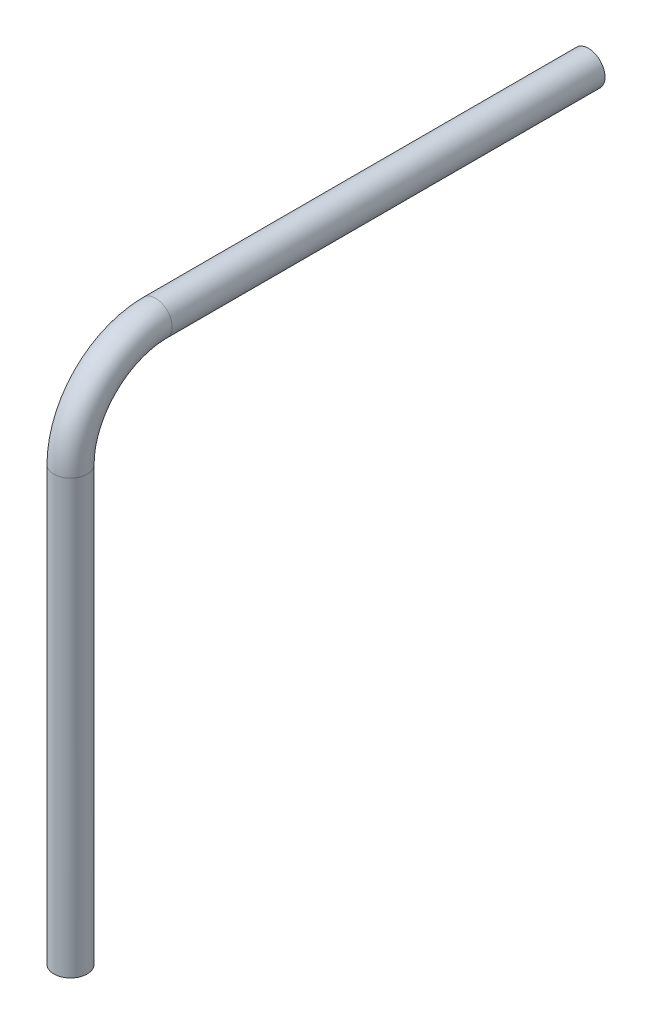
from build123d import *

# Parameters (mm, degrees)
SKETCH3_R           = 12.7
SKETCH3_R_2         = 4.7625
SKETCH4_R           = 12.7
SKETCH4_R_2         = 4.7625
BOSS_EXTRUDE3_DEPTH = 330.2
SKETCH5_R           = 12.7
SKETCH5_R_2         = 4.7625
BOSS_EXTRUDE4_DEPTH = 330.2
SKETCH6_W           = 12.7
SKETCH6_H           = 152.4
CUT_EXTRUDE1_DEPTH  = 6.35


with BuildPart() as part:
    # Sweep1: sweep along a path in Sketch2
    with BuildLine(Plane(origin=(0, 0, 0), x_dir=(0, 0, -1), z_dir=(1, 0, 0))) as sweep1_path:
        ThreePointArc((-64.833774642, 0), (-45.844401699, 45.844401699), (0, 64.833774642))
    # Sketch3 → Sweep1 (sweep)
    with BuildSketch(Plane(origin=(0, 0, 0), x_dir=(1, 0, 0), z_dir=(0, 1, 0))):
        with Locations((0, -64.833774642)):
            Circle(SKETCH3_R)
        with Locations((0, -64.833774642)):
            Circle(SKETCH3_R_2, mode=Mode.SUBTRACT)
    sweep(path=sweep1_path.line)

    # Sketch4 → Boss-Extrude3 (add)
    with BuildSketch(Plane(origin=(0, 0, 0), x_dir=(-1, 0, 0), z_dir=(0, -1, 0))):
        with Locations((0, -64.833774642)):
            Circle(SKETCH4_R)
        with Locations((0, -64.833774642)):
            Circle(SKETCH4_R_2, mode=Mode.SUBTRACT)
    extrude(amount=BOSS_EXTRUDE3_DEPTH)

    # Sketch5 → Boss-Extrude4 (add)
    with BuildSketch(Plane(origin=(0, 0, 0), x_dir=(-1, 0, 0), z_dir=(0, 0, -1))):
        with Locations((0, 64.833774642)):
            Circle(SKETCH5_R)
        with Locations((0, 64.833774642)):
            Circle(SKETCH5_R_2, mode=Mode.SUBTRACT)
    extrude(amount=BOSS_EXTRUDE4_DEPTH)

    # Sketch6 → Cut-Extrude1 (cut)
    with BuildSketch(Plane.ZY.offset(12.7)):
        with Locations((63.5, -76.2)):
            Rectangle(SKETCH6_W, SKETCH6_H)
    extrude(amount=-CUT_EXTRUDE1_DEPTH, mode=Mode.SUBTRACT)


solid = part.part
